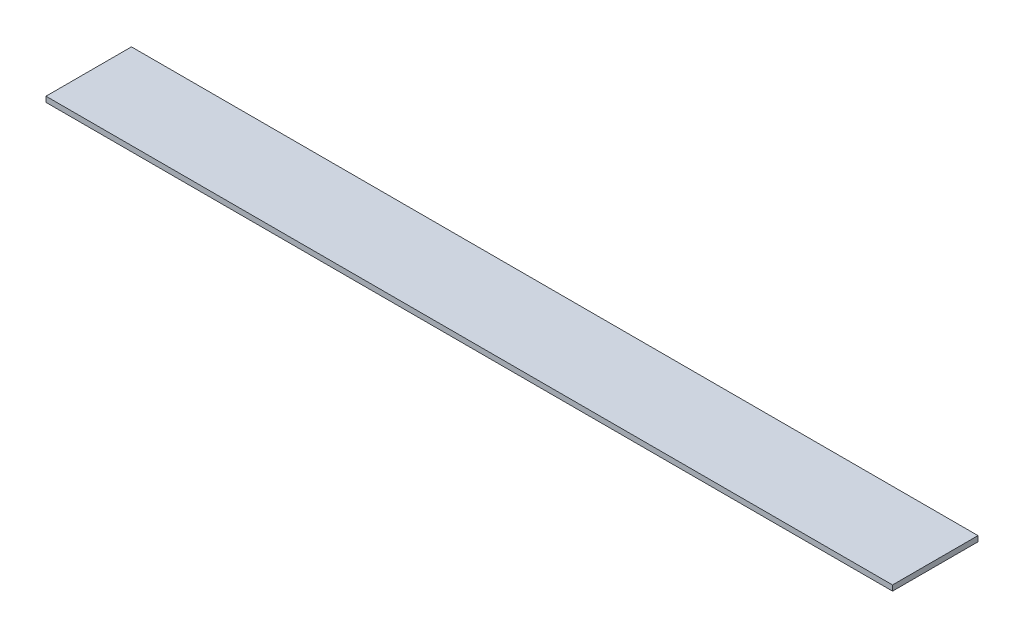
from build123d import *

# Parameters (mm, degrees)
SKETCH1_W          = 1880
SKETCH1_H          = 189.8
BASE_FLANGE1_DEPTH = 12


# Sheet-metal steps are written as plain solids
with BuildPart() as part:
    # Sketch1 → Base-Flange1 (new body)
    with BuildSketch(Plane(origin=(0, 0, 0), x_dir=(1, 0, 0), z_dir=(0, 1, 0))):
        Rectangle(SKETCH1_W, SKETCH1_H)
    extrude(amount=-BASE_FLANGE1_DEPTH)


solid = part.part
